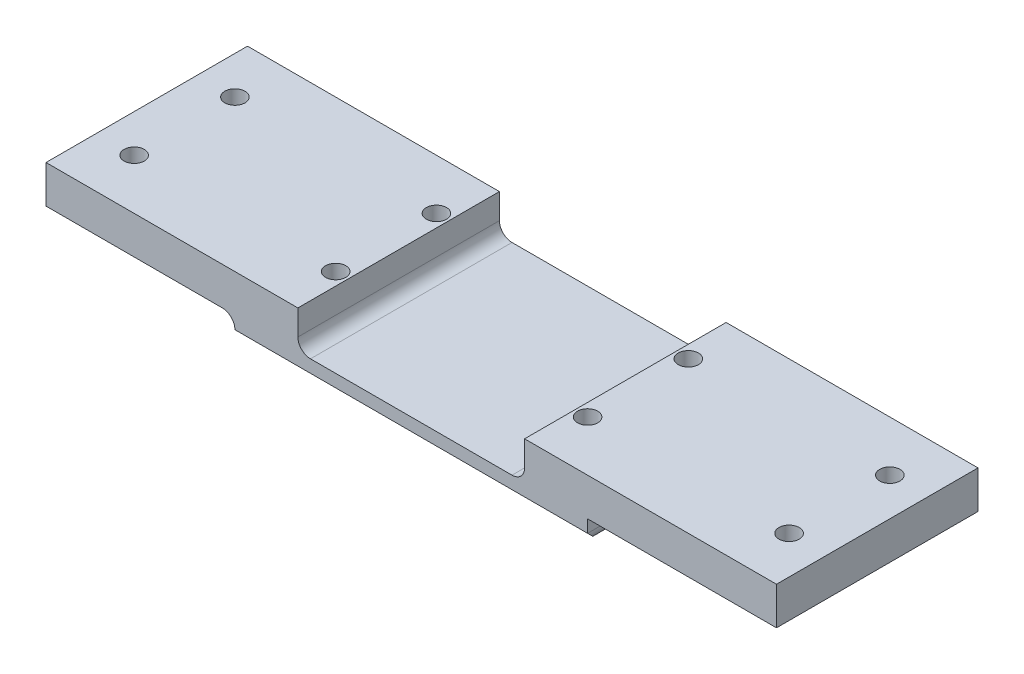
from build123d import *

# Parameters (mm, degrees)
SKETCH1_W              = 184.15
SKETCH1_H              = 50.8
BOSS_EXTRUDE1_DEPTH    = 9.525
SKETCH4_W              = 88.9
SKETCH4_H              = 6.35
BOSS_EXTRUDE2_DEPTH    = 50.8
SKETCH5_W              = 57.15
SKETCH5_H              = 50.8
CUT_EXTRUDE1_DEPTH     = 9.525
F_10_CLEARANCE_HOLE1_D = 5.1054
FILLET1_R              = 3.175
CHAMFER1_SIZE          = 3.175


# Some blends are built 0.0001 mm under size
with BuildPart() as part:
    # Sketch1 → Boss-Extrude1 (new body)
    with BuildSketch(Plane(origin=(0, 0, 0), x_dir=(1, 0, 0), z_dir=(0, 1, 0))):
        with Locations((92.075, 25.4)):
            Rectangle(SKETCH1_W, SKETCH1_H)
    extrude(amount=BOSS_EXTRUDE1_DEPTH)

    # Sketch4 → Boss-Extrude2 (add)
    with BuildSketch(Plane.XY):
        with Locations((92.075, -3.175)):
            Rectangle(SKETCH4_W, SKETCH4_H)
    extrude(amount=-BOSS_EXTRUDE2_DEPTH)

    # Sketch5 → Cut-Extrude1 (cut)
    with BuildSketch(Plane(origin=(0, 9.525, 0), x_dir=(1, 0, 0), z_dir=(0, 1, 0))):
        with Locations((92.075, 25.4)):
            Rectangle(SKETCH5_W, SKETCH5_H)
    extrude(amount=-CUT_EXTRUDE1_DEPTH, mode=Mode.SUBTRACT)

    # #10 Clearance Hole1 (through all)
    with Locations(Plane(origin=(0, 9.525, 0), x_dir=(1, 0, 0), z_dir=(0, 1, 0))):
        with Locations((9.525, 38.1), (9.525, 12.7), (60.325, 12.7), (60.325, 38.1), (123.825, 38.1), (123.825, 12.7), (174.625, 12.7), (174.625, 38.1)):
            Hole(F_10_CLEARANCE_HOLE1_D / 2)

    # Fillet1
    fillet1_edges = [part.edges().sort_by_distance(p)[0] for p in [
        (47.625, 0, -25.4),
        (47.625, -6.35, -25.4),
        (136.525, -6.35, -25.4),
        (63.5, 0, -25.4),
        (120.65, 0, -25.4),
    ]]
    fillet(fillet1_edges, radius=FILLET1_R - 0.0001)  # a hair under: the kernel refuses the full size

    # Chamfer1
    # the kernel refuses this chamfer: 3.175 mm, written as the material it takes off along each edge
    with BuildSketch(Plane(origin=(141.515193487, -6.35, 0), x_dir=(0, 0.9996219169112966, 0.02749587661058637), z_dir=(-1, 0, 0))) as chamfer1_piece_1:
        Polygon((CHAMFER1_SIZE * 0.999621916911, CHAMFER1_SIZE * 0.0274958766106), (-CHAMFER1_SIZE * 0.0274958766106, CHAMFER1_SIZE * 0.999621916911), (0, 0), align=None)
    extrude(amount=98.880386974, mode=Mode.SUBTRACT)


solid = part.part
